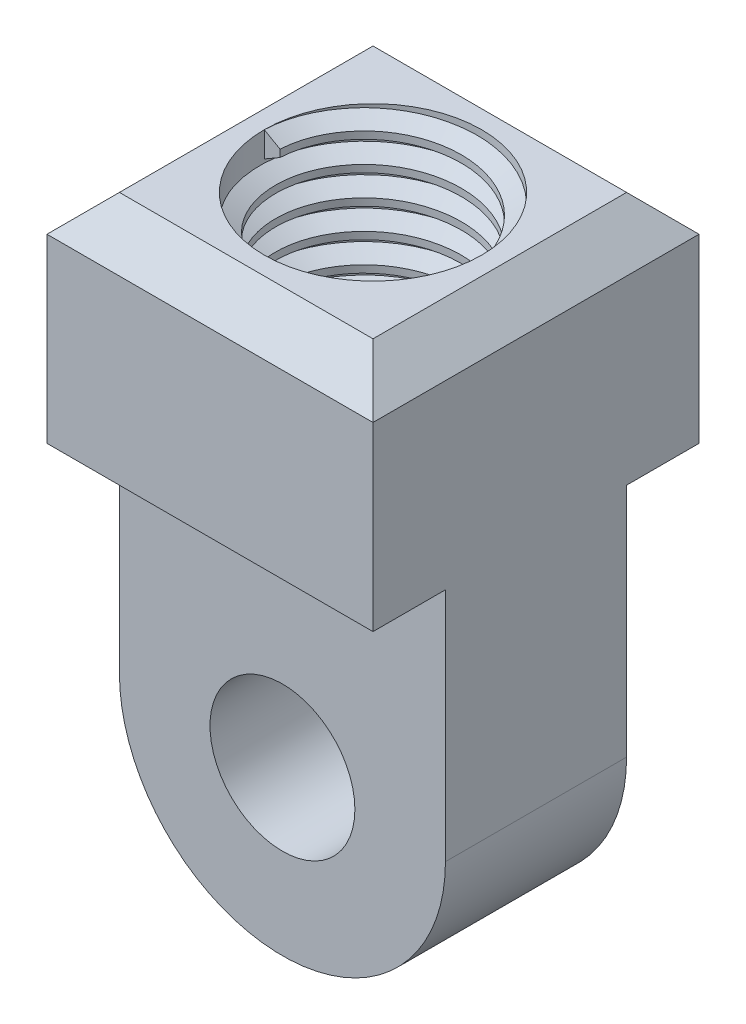
from build123d import *

# Parameters (mm, degrees)
SKETCH1_R           = 2
BOSS_EXTRUDE1_DEPTH = 5
SKETCH2_W           = 9
SKETCH2_H           = 9
BOSS_EXTRUDE2_DEPTH = 6
CHAMFER1_SIZE       = 1
SKETCH3_R           = 3
CUT_EXTRUDE1_DEPTH  = 5
THREAD1_PITCH       = 0.8


with BuildPart() as part:
    # Sketch1 → Boss-Extrude1 (new body)
    with BuildSketch(Plane.XY):
        with BuildLine():
            Line((9, 0), (9, 6.5))
            Line((9, 6.5), (0, 6.5))
            Line((0, 6.5), (0, 0))
            ThreePointArc((0, 0), (4.5, -4.5), (9, 0))
        make_face()
        with Locations((4.5, 0)):
            Circle(SKETCH1_R, mode=Mode.SUBTRACT)
    extrude(amount=BOSS_EXTRUDE1_DEPTH)

    # Sketch2 → Boss-Extrude2 (add)
    with BuildSketch(Plane(origin=(0, 6.5, 0), x_dir=(1, 0, 0), z_dir=(0, 1, 0))):
        with Locations((4.5, -2.5)):
            Rectangle(SKETCH2_W, SKETCH2_H)
    extrude(amount=BOSS_EXTRUDE2_DEPTH)

    # Chamfer1
    chamfer1_edges = [part.edges().sort_by_distance(p)[0] for p in [
        (0, 12.5, 2.5),
        (4.5, 12.5, 7),
        (9, 12.5, 2.5),
        (4.5, 12.5, -2),
    ]]
    chamfer(chamfer1_edges, length=CHAMFER1_SIZE)

    # Sketch3 → Cut-Extrude1 (cut)
    with BuildSketch(Plane(origin=(0, 12.5, 0), x_dir=(1, 0, 0), z_dir=(0, 1, 0))):
        with Locations(Location((4.5, -2.5, 0), (0, 0, 180))):
            Circle(SKETCH3_R)
    extrude(amount=-CUT_EXTRUDE1_DEPTH, mode=Mode.SUBTRACT)

    # Thread1: the profile of Thread Profile1 profile screwed along a right-hand helix of 6.25 turns, 8 arcs to a turn; built about Z, then put on its axis
    thread1_z = Axis((0, 0, 0), (0, 0, 1))
    thread1_corners = [(3.0003, 0, -0.000173205), (3.0003, 0, 0.700173203), (2.5669873, 0, 0.449999999), (2.5669873, 0, 0.249999999)]
    with BuildLine(mode=Mode.PRIVATE) as thread1_profile:
        Line(thread1_corners[0], thread1_corners[1])
        Line(thread1_corners[1], thread1_corners[2])
        Line(thread1_corners[2], thread1_corners[3])
        Line(thread1_corners[3], thread1_corners[0])
    thread1_cap = Face(thread1_profile.wire())
    thread1_turn_angles = [0, 22.5, 45, 67.5, 90, 112.5, 135, 157.5, 180, 202.5, 225, 247.5, 270, 292.5, 315, 337.5, 360]
    thread1_turn_weights = [1, 0.9238795325112867, 1, 0.9238795325112867, 1, 0.9238795325112867, 1, 0.9238795325112867, 1, 0.9238795325112867, 1, 0.9238795325112867, 1, 0.9238795325112867, 1, 0.9238795325112867, 1]
    thread1_turn_rails = [Edge.make_bspline([Vector(p[0], p[1], 0).rotate(thread1_z, thread1_turn_angles[k]) / thread1_turn_weights[k] + Vector(0, 0, p[2] + THREAD1_PITCH * thread1_turn_angles[k] / 360) for k in range(17)], [0, 0, 0, 1, 1, 2, 2, 3, 3, 4, 4, 5, 5, 6, 6, 7, 7, 8, 8, 8], 2, thread1_turn_weights) for p in thread1_corners]
    thread1_turn_sides = [Face.make_surface_from_curves(thread1_turn_rails[p[0]], thread1_turn_rails[p[1]]) for p in [(0, 1), (1, 2), (2, 3), (3, 0)]]
    thread1_last_angles = [2160, 2182.5, 2205, 2227.5, 2250]
    thread1_last_weights = [1, 0.9238795325112867, 1, 0.9238795325112867, 1]
    thread1_last_rails = [Edge.make_bspline([Vector(p[0], p[1], 0).rotate(thread1_z, thread1_last_angles[k]) / thread1_last_weights[k] + Vector(0, 0, p[2] + THREAD1_PITCH * thread1_last_angles[k] / 360) for k in range(5)], [0, 0, 0, 1, 1, 2, 2, 2], 2, thread1_last_weights) for p in thread1_corners]
    thread1_last_sides = [Face.make_surface_from_curves(thread1_last_rails[p[0]], thread1_last_rails[p[1]]) for p in [(0, 1), (1, 2), (2, 3), (3, 0)]]
    thread1 = Plane(origin=(4.5, 12.5, 2.5), x_dir=(-1, 0, 0), z_dir=(0, -1, 0)) * Solid(Shell([*[p.moved(Location((0, 0, THREAD1_PITCH * i))) for i in range(6) for p in thread1_turn_sides], *thread1_last_sides, thread1_cap, thread1_cap.rotate(thread1_z, 2250).moved(Location((0, 0, THREAD1_PITCH * 2250 / 360)))]))
    add(thread1)


solid = part.part
